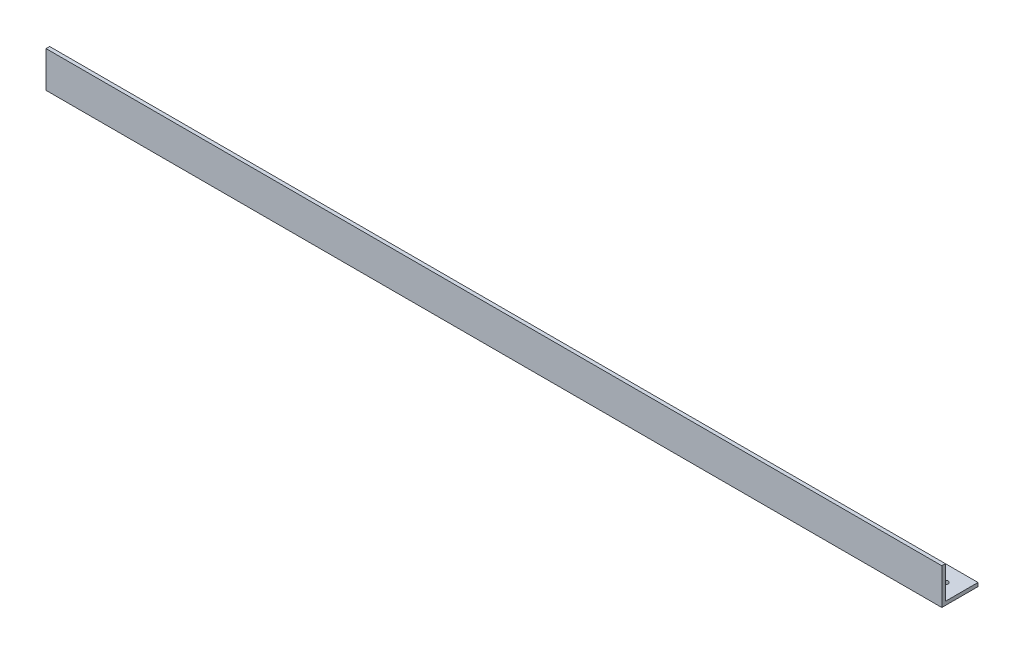
from build123d import *

# Parameters (mm, degrees)
BOSS_EXTRUDE1_DEPTH      = 325
BOSS_EXTRUDE1_DEPTH_BACK = 170
SKETCH2_R                = 2.5
SKETCH2_R_2              = 1.5
CUT_EXTRUDE1_DEPTH       = 2


with BuildPart() as part:
    # Sketch1 → Boss-Extrude1 (new, two sides: drawn at the far end of the back side and taken through both)
    with BuildSketch(Plane(origin=(0, 0, 0), x_dir=(0, 0, -1), z_dir=(1, 0, 0)).offset(-BOSS_EXTRUDE1_DEPTH_BACK)):
        Polygon((0, 20), (0, 0), (20, 0), (20, 2), (2, 2), (2, 20), align=None)
    extrude(amount=BOSS_EXTRUDE1_DEPTH + BOSS_EXTRUDE1_DEPTH_BACK)

    # Sketch2 → Cut-Extrude1 (cut)
    with BuildSketch(Plane(origin=(0, 2, 0), x_dir=(1, 0, 0), z_dir=(0, 1, 0))):
        with Locations((0, 12.5)):
            Circle(SKETCH2_R)
        with Locations((316, 11)):
            Circle(SKETCH2_R_2)
        with Locations((-161, 11)):
            Circle(SKETCH2_R_2)
    extrude(amount=-CUT_EXTRUDE1_DEPTH, mode=Mode.SUBTRACT)


solid = part.part
